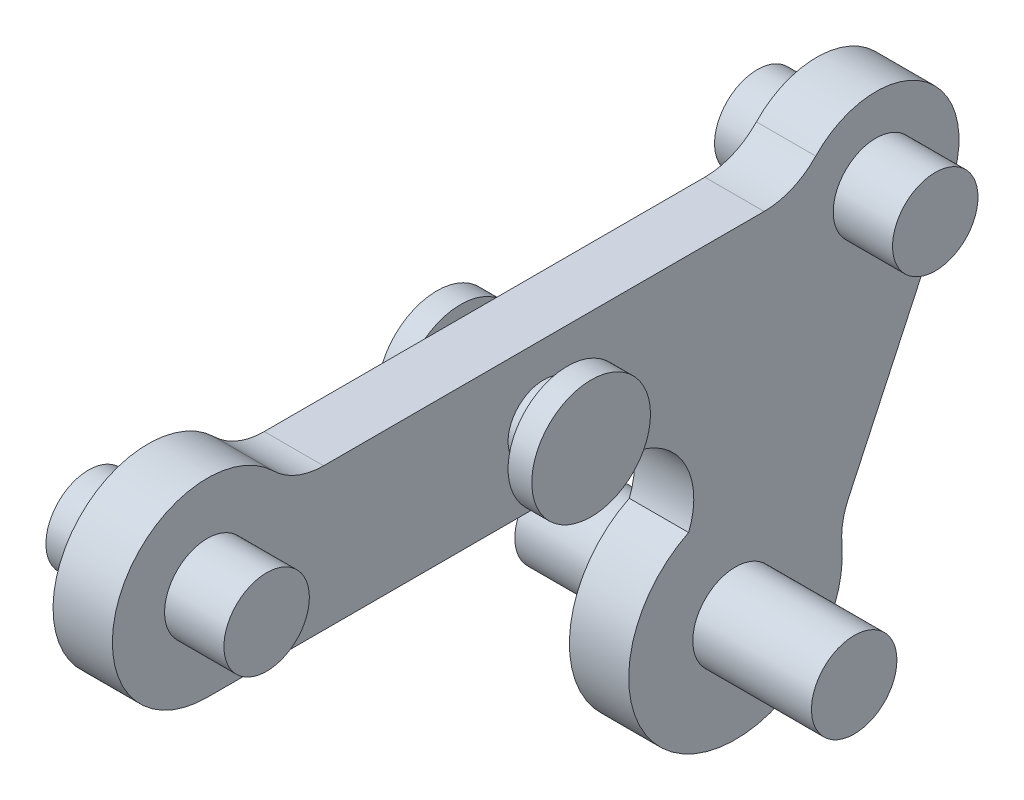
from build123d import *

# Parameters (mm, degrees)
EXTRUDE_1_DEPTH     = 1.25
SKETCH_1_3_R        = 2
CUT_EXTRUDE_1_DEPTH = 37.497164572
FILLET_1_R          = 3
EXTRUDE_START       = -1.25
SKETCH_2_R          = 2
EXTRUDE_2_DEPTH     = 1.25
SKETCH_2_5_R        = 1.8
EXTRUDE_5_DEPTH     = 2.5
SKETCH_2_7_R        = 1.8
EXTRUDE_7_DEPTH     = 5
EXTRUDE_8_DEPTH     = 1
EXTRUDE_START_2     = 1
SKETCH_3_3_R        = 2.5
EXTRUDE_9_DEPTH     = 1


with BuildPart() as part:
    # 草图1 → 凸台-拉伸1 (new body)
    with BuildSketch(Plane(origin=(0, 0, 0), x_dir=(0, 0, -1), z_dir=(1, 0, 0))):
        with BuildLine():
            Line((-28.172077255, -4.520836084), (-28.172077255, 1.479163916))
            Line((-28.172077255, 1.479163916), (-24.707975639, 1.479163916))
            ThreePointArc((-24.707975639, 1.479163916), (-31.63617887, 1.479163916), (-28.172077255, -4.520836084))
        make_face()
        with BuildLine():
            Line((-24.707975639, 1.479163916), (-28.172077255, 1.479163916))
            Line((-28.172077255, 1.479163916), (-28.172077255, -4.520836084))
            ThreePointArc((-28.172077255, -4.520836084), (-25.34365013, -3.349263209), (-24.172077255, -0.520836084))
            ThreePointArc((-24.172077255, -0.520836084), (-24.308373949, 0.514440097), (-24.707975639, 1.479163916))
        make_face()
        with BuildLine():
            Line((-3.172077255, 1.479163916), (-24.707975639, 1.479163916))
            ThreePointArc((-24.707975639, 1.479163916), (-24.308373949, 0.514440097), (-24.172077255, -0.520836084))
            ThreePointArc((-24.172077255, -0.520836084), (-25.34365013, -3.349263209), (-28.172077255, -4.520836084))
            Line((-28.172077255, -4.520836084), (-5.969923204, -4.520836084))
            Line((-5.969923204, -4.520836084), (-3.172077255, 1.479163916))
        make_face()
        with BuildLine():
            Line((3.172077255, -1.479163916), (-3.172077255, 1.479163916))
            Line((-3.172077255, 1.479163916), (-3.172077255, -1.479163916))
            ThreePointArc((-3.172077255, -1.479163916), (0, -3.5), (3.172077255, -1.479163916))
        make_face()
        with BuildLine():
            ThreePointArc((3.5, 0), (0.757538649, 3.417036025), (-3.172077255, 1.479163916))
            Line((-3.172077255, 1.479163916), (3.172077255, -1.479163916))
            ThreePointArc((3.172077255, -1.479163916), (3.417036025, -0.757538649), (3.5, 0))
        make_face()
        with BuildLine():
            ThreePointArc((-3.172077255, -1.479163916), (-3.5, 0), (-3.172077255, 1.479163916))
            Line((-3.172077255, 1.479163916), (-5.969923204, -4.520836084))
            Line((-5.969923204, -4.520836084), (-3.172077255, -4.520836084))
            Line((-3.172077255, -4.520836084), (-3.172077255, -1.479163916))
        make_face()
        with BuildLine():
            Line((-3.172077255, -1.479163916), (-3.172077255, 1.479163916))
            ThreePointArc((-3.172077255, 1.479163916), (-3.5, 0), (-3.172077255, -1.479163916))
        make_face()
        with BuildLine():
            Line((-3.172077255, -4.520836084), (-5.969923204, -4.520836084))
            Line((-5.969923204, -4.520836084), (-7.893387964, -8.645719574))
            ThreePointArc((-7.893387964, -8.645719574), (-4.014873487, -8.609923977), (-1.549233455, -11.604047406))
            Line((-1.549233455, -11.604047406), (3.172077255, -1.479163916))
            ThreePointArc((3.172077255, -1.479163916), (0, -3.5), (-3.172077255, -1.479163916))
            Line((-3.172077255, -1.479163916), (-3.172077255, -4.520836084))
        make_face()
        with BuildLine():
            ThreePointArc((-1.549233455, -11.604047406), (-4.014873487, -8.609923977), (-7.893387964, -8.645719574))
            Line((-7.893387964, -8.645719574), (-9.088732919, -11.209145102))
            Line((-9.088732919, -11.209145102), (-2.74457841, -14.167472935))
            Line((-2.74457841, -14.167472935), (-1.549233455, -11.604047406))
        make_face()
        with BuildLine():
            Line((-9.088732919, -11.209145102), (-7.893387964, -8.645719574))
            ThreePointArc((-7.893387964, -8.645719574), (-8.299375187, -16.50572276), (-1.416655664, -12.688309019))
            ThreePointArc((-1.416655664, -12.688309019), (-1.449923081, -12.14214052), (-1.549233455, -11.604047406))
            Line((-1.549233455, -11.604047406), (-2.74457841, -14.167472935))
            Line((-2.74457841, -14.167472935), (-9.088732919, -11.209145102))
        make_face()
    extrude(amount=EXTRUDE_1_DEPTH)

    # 草图1<3> → 切除-拉伸1 (cut, through all)
    with BuildSketch(Plane(origin=(0, 0, 0), x_dir=(0, 0, -1), z_dir=(1, 0, 0))):
        with Locations((-28.172077255, -0.520836084)):
            Circle(SKETCH_1_3_R)
        Circle(SKETCH_1_3_R)
        with Locations((-5.916655664, -12.688309019)):
            Circle(SKETCH_1_3_R)
    extrude(amount=CUT_EXTRUDE_1_DEPTH, mode=Mode.SUBTRACT)

    # 圆角1
    # the kernel refuses this fillet: 3 mm, written as the material it adds along each edge
    with BuildSketch(Plane(origin=(0, -11.604047406, 1.549233455), x_dir=(0, 0.9063077870366663, -0.4226182617406644), z_dir=(1, 0, 0))) as fillet_1_piece_1:
        with BuildLine():
            CenterArc((0.913230262, -3), FILLET_1_R, 90, 29.926434867)
            Line((-0.583432693, -0.4), (-0.613365952, -0.348))
            ThreePointArc((-0.613365952, -0.348), (-0.317772106, -0.161995545), (-0.037712362, 0.046666667))
            Line((-0.037712362, 0.046666667), (0, 0.06))
            Line((0, 0.06), (0.913230262, 0.06))
            Line((0.913230262, 0.06), (0.913230262, 0))
        make_face()
    extrude(amount=1.25)
    with BuildSketch(Plane(origin=(0, 1.479163916, 3.172077255), x_dir=(0, 0, 1), z_dir=(1, 0, 0))) as fillet_1_piece_2:
        with BuildLine():
            CenterArc((1.538240209, -3), FILLET_1_R, 90, 46.440922497)
            Line((-0.635752466, -0.932693577), (-0.67923232, -0.891347449))
            ThreePointArc((-0.67923232, -0.891347449), (-0.329607023, -0.458350724), (-0.054378467, 0.025357096))
            Line((-0.054378467, 0.025357096), (0, 0.06))
            Line((0, 0.06), (1.538240209, 0.06))
            Line((1.538240209, 0.06), (1.538240209, 0))
        make_face()
    extrude(amount=1.25)
    with BuildSketch(Plane(origin=(0, 1.479163916, 24.707975639), x_dir=(0, 0.7902368852402469, 0.6128014892326821), z_dir=(1, 0, 0))) as fillet_1_piece_3:
        with BuildLine():
            CenterArc((1.49141536, -2.972297887), FILLET_1_R, 97.792345701, 44.415308597)
            Line((-0.879295296, -1.133893419), (-0.926709509, -1.09712533))
            Line((-0.926709509, -1.09712533), (-0.047414213, 0.036768089))
            Line((-0.047414213, 0.036768089), (0.008134993, 0.059445958))
            ThreePointArc((0.008134993, 0.059445958), (0.542332858, 0.023063849), (1.076530723, 0.059445958))
            Line((1.076530723, 0.059445958), (1.084665716, 0))
        make_face()
    extrude(amount=1.25)
    with BuildSketch(Plane(origin=(0, -4.520836084, 5.969923204), x_dir=(0, 0, 1), z_dir=(1, 0, 0))) as fillet_1_piece_4:
        with BuildLine():
            CenterArc((4.704586321, 3), FILLET_1_R, 157.978087479, 112.021912521)
            Line((1.923464761, 4.12488349), (1.867842329, 4.14738116))
            ThreePointArc((1.867842329, 4.14738116), (0.907353913, 2.087798841), (-0.054378467, 0.025357096))
            Line((-0.054378467, 0.025357096), (0, -0.06))
            Line((0, -0.06), (4.704586321, -0.06))
            Line((4.704586321, -0.06), (4.704586321, 0))
        make_face()
    extrude(amount=1.25)

    # 草图2 → 凸台-拉伸2 (add)
    with BuildSketch(Plane(origin=(1.25, 0, 0), x_dir=(0, 0, -1), z_dir=(1, 0, 0)).offset(EXTRUDE_START)):
        Circle(SKETCH_2_R)
        with Locations((-5.916655664, -12.688309019)):
            Circle(SKETCH_2_R)
        with Locations((-28.172077255, -0.520836084)):
            Circle(SKETCH_2_R)
    extrude(amount=EXTRUDE_2_DEPTH)

    # 草图2<5> → 凸台-拉伸5 (add)
    with BuildSketch(Plane(origin=(1.25, 0, 0), x_dir=(0, 0, -1), z_dir=(1, 0, 0))):
        with Locations((-28.172077255, -0.520836084)):
            Circle(SKETCH_2_5_R)
        Circle(SKETCH_2_5_R)
    extrude(amount=EXTRUDE_5_DEPTH)

    # 草图2<7> → 凸台-拉伸7 (add)
    with BuildSketch(Plane(origin=(1.25, 0, 0), x_dir=(0, 0, -1), z_dir=(1, 0, 0))):
        with Locations((-5.916655664, -12.688309019)):
            Circle(SKETCH_2_7_R)
    extrude(amount=EXTRUDE_7_DEPTH)

    # 草图3 → 凸台-拉伸8 (add)
    with BuildSketch(Plane(origin=(1.25, 0, 0), x_dir=(0, 0, -1), z_dir=(1, 0, 0))):
        with BuildLine():
            ThreePointArc((-12.5, -1.520836084), (-12.939339828, -0.460175912), (-14, -0.020836084))
            Line((-14, -0.020836084), (-14, -3.020836084))
            ThreePointArc((-14, -3.020836084), (-12.939339828, -2.581496256), (-12.5, -1.520836084))
        make_face()
        with BuildLine():
            Line((-14, -3.020836084), (-14, -0.020836084))
            ThreePointArc((-14, -0.020836084), (-15.5, -1.520836084), (-14, -3.020836084))
        make_face()
    extrude(amount=EXTRUDE_8_DEPTH)

    # 草图3<3> → 凸台-拉伸9 (add)
    with BuildSketch(Plane(origin=(1.25, 0, 0), x_dir=(0, 0, -1), z_dir=(1, 0, 0)).offset(EXTRUDE_START_2)):
        with Locations((-14, -1.520836084)):
            Circle(SKETCH_3_3_R)
    extrude(amount=EXTRUDE_9_DEPTH)

    # 镜向1: part across plane


with BuildPart() as part_1:
    add(part.part)
    add(part.part.mirror(Plane.ZY))


solid = part_1.part
